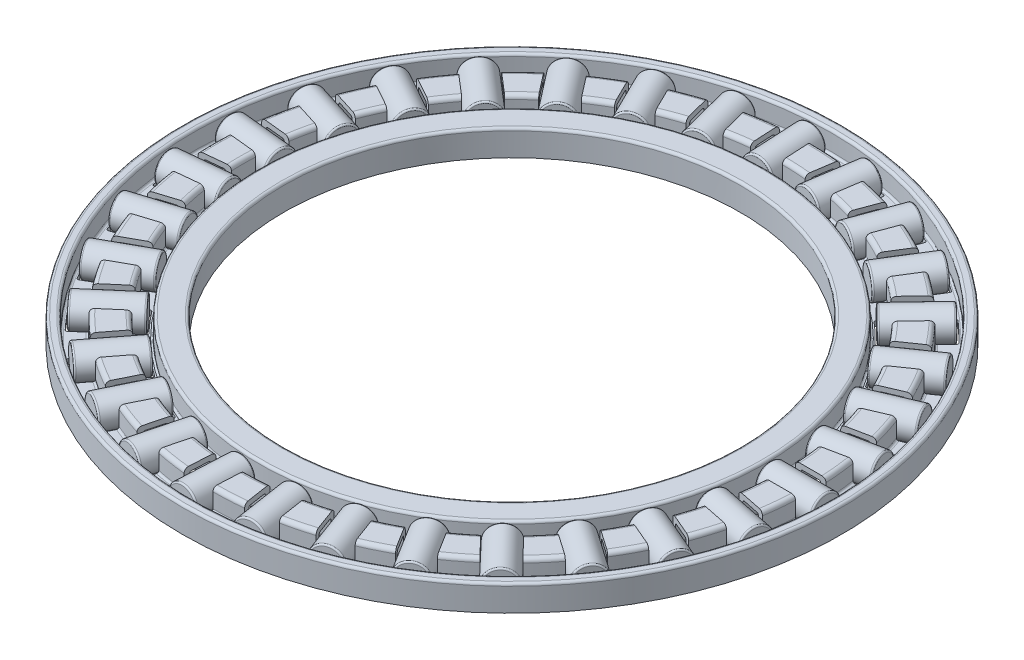
from build123d import *

# Parameters (mm, degrees)
FILLET1_R                = 0.4
FILLET2_R                = 0.4
FILLET3_R                = 0.25
FILLET4_R                = 0.2
CUT_EXTRUDE1_DEPTH       = 46.979621918
FILLET5_R                = 0.150057938
CIRPATTERN1_COUNT        = 31
FILLET5_OF_CIRPATTERN1_R = 0.150057938
SKETCH5_W                = 5.556293558
SKETCH5_H                = 1.5
FILLET6_R                = 0.150057938
CIRPATTERN2_COUNT        = 31


with BuildPart() as part:
    # Sketch3 → Revolve1 (revolve)
    with BuildSketch(Plane(origin=(0, 0, 0), x_dir=(0, 0, -1), z_dir=(1, 0, 0)), mode=Mode.PRIVATE) as revolve1_sk:
        Polygon((23.35, -1.275), (23.35, 0.779166667), (24.175, 0.779166667), (24.175, -1.275), (27.004166667, -1.275), (27.004166667, 0.779166667), (29.004166667, 0.779166667), (29.004166667, -1.275), (31.833333333, -1.275), (31.833333333, 0.779166667), (32.166666667, 0.779166667), (32.166666667, -1.275), (32.5, -1.275), (32.5, 1.275), (31.5, 1.275), (31.5, -0.779166667), (29.5, -0.779166667), (29.5, 1.275), (26.508333333, 1.275), (26.508333333, -0.779166667), (25, -0.779166667), (25, 1.275), (22.525, 1.275), (22.525, -1.275), align=None)
    revolve(revolve1_sk.sketch.rotate(Axis((0, 1.5, 0), (0, -1, 0)), 180), axis=Axis((0, 1.5, 0), (0, -1, 0)))

    # Fillet1
    fillet1_edges = [part.edges().sort_by_distance(p)[0] for p in [
        (0, -1.275, -31.833333333),
        (0, -1.275, -29.004166667),
        (0, -1.275, -27.004166667),
        (0, -1.275, -24.175),
    ]]
    fillet(fillet1_edges, radius=FILLET1_R)

    # Fillet2
    fillet2_edges = [part.edges().sort_by_distance(p)[0] for p in [
        (0, 1.275, -26.508333333),
        (0, 1.275, -29.5),
    ]]
    fillet(fillet2_edges, radius=FILLET2_R)

    # Fillet3
    fillet3_edges = [part.edges().sort_by_distance(p)[0] for p in [
        (0, 1.275, -22.525),
        (0, 1.275, -25),
        (0, 1.275, -31.5),
        (0, 1.275, -32.5),
    ]]
    fillet(fillet3_edges, radius=FILLET3_R)

    # Fillet4
    fillet4_edges = [part.edges().sort_by_distance(p)[0] for p in [
        (0, -0.779166667, -25),
        (0, -0.779166667, -26.508333333),
        (0, -0.779166667, -29.5),
        (0, -0.779166667, -31.5),
        (0, 0.779166667, -29.004166667),
        (0, 0.779166667, -27.004166667),
    ]]
    fillet(fillet4_edges, radius=FILLET4_R)

    # Sketch4 → Cut-Extrude1 (cut, symmetric)
    with BuildSketch(Plane(origin=(0, 0, 0), x_dir=(1, 0, 0), z_dir=(0, 1, 0))):
        with BuildLine():
            Line((25.280538463, 1.5), (31.138892482, 1.5))
            ThreePointArc((31.138892482, 1.5), (31.175, 0), (31.138892482, -1.5))
            Line((31.138892482, -1.5), (25.280538463, -1.5))
            ThreePointArc((25.280538463, -1.5), (25.325, 0), (25.280538463, 1.5))
        make_face()
    cut_extrude1 = extrude(amount=CUT_EXTRUDE1_DEPTH, both=True, mode=Mode.SUBTRACT)

    # Fillet5
    fillet5_edges = [part.edges().sort_by_distance(p)[0] for p in [
        (31.138892482, -1.027083333, -1.5),
        (25.280538463, -1.027083333, 1.5),
        (25.280538463, -1.027083333, -1.5),
        (31.138892482, -1.027083333, 1.5),
    ]]
    fillet(fillet5_edges, radius=FILLET5_R)

    # CirPattern1: Cut-Extrude1 ×31 about axis
    cirpattern1_axis = Axis((0, 0, 0), (0, 1, 0))
    for i in range(1, CIRPATTERN1_COUNT):
        add(cut_extrude1.rotate(cirpattern1_axis, i * 360 / CIRPATTERN1_COUNT), mode=Mode.SUBTRACT)

    # Fillet5 of CirPattern1
    fillet5_of_cirpattern1_edges = [part.edges().sort_by_distance(p)[0] for p in [
        (30.199529743, -1.027083333, -7.737507886),
        (25.064992136, -1.027083333, -3.619640068),
        (24.461096576, -1.027083333, -6.558229892),
        (30.803425304, -1.027083333, -4.798918062),
        (28.023794709, -1.027083333, -13.658241289),
        (23.823282086, -1.027083333, -8.591091646),
        (22.64021452, -1.027083333, -11.347965081),
        (29.206862274, -1.027083333, -10.901367855),
        (24.700762226, -1.027083333, -19.01980469),
        (21.606244067, -1.027083333, -13.210822923),
        (19.892439422, -1.027083333, -15.673113246),
        (26.414566871, -1.027083333, -16.557514366),
        (20.366477636, -1.027083333, -23.602695052),
        (18.504643879, -1.027083333, -17.289701557),
        (16.330265517, -1.027083333, -19.356602314),
        (22.540855998, -1.027083333, -21.535794295),
        (15.198387058, -1.027083333, -27.219288305),
        (14.645461395, -1.027083333, -20.660737778),
        (12.099528623, -1.027083333, -22.247629809),
        (17.744319831, -1.027083333, -25.632396274),
        (9.408072729, -1.027083333, -29.721520697),
        (10.186692001, -1.027083333, -23.185920967),
        (7.373435605, -1.027083333, -24.227836725),
        (12.221329125, -1.027083333, -28.679604938),
        (3.232590796, -1.027083333, -31.006950539),
        (5.31087824, -1.027083333, -24.761869827),
        (2.345473267, -1.027083333, -25.216153159),
        (6.197995769, -1.027083333, -30.552667207),
        (-3.075233784, -1.027083333, -31.022952183),
        (0.2176365, -1.027083333, -25.324064827),
        (-2.778513022, -1.027083333, -25.17211732),
        (-0.079084262, -1.027083333, -31.17489969),
        (-9.257157931, -1.027083333, -29.76887052),
        (-4.884515304, -1.027083333, -24.849489637),
        (-7.788746661, -1.027083333, -24.097532041),
        (-6.352926574, -1.027083333, -30.520828117),
        (-15.060092944, -1.027083333, -27.2960478),
        (-9.786694478, -1.027083333, -23.357573423),
        (-12.480108097, -1.027083333, -22.036390968),
        (-12.366679326, -1.027083333, -28.617230255),
        (-20.246465983, -1.027083333, -23.705721676),
        (-14.28820523, -1.027083333, -20.909395407),
        (-16.660532441, -1.027083333, -19.07307746),
        (-17.874138773, -1.027083333, -25.542039624),
        (-24.603946326, -1.027083333, -19.144880521),
        (-18.204755181, -1.027083333, -17.605184288),
        (-20.158872629, -1.027083333, -15.328909919),
        (-22.649828878, -1.027083333, -21.421154889),
        (-27.954138216, -1.027083333, -13.800245708),
        (-21.376000316, -1.027083333, -13.580214854),
        (-22.831906204, -1.027083333, -10.957175006),
        (-26.498232328, -1.027083333, -16.423285557),
        (-30.159884402, -1.027083333, -7.890627215),
        (-23.672109486, -1.027083333, -8.999269829),
        (-24.570198855, -1.027083333, -6.13685206),
        (-29.261795033, -1.027083333, -10.753044984),
        (-31.130881378, -1.027083333, -1.657965516),
        (-24.999079713, -1.027083333, -4.04989364),
        (-25.302584679, -1.027083333, -1.06528567),
        (-30.827376412, -1.027083333, -4.642573486),
        (-30.827376412, -1.027083333, 4.642573486),
        (-25.302584679, -1.027083333, 1.06528567),
        (-24.999079713, -1.027083333, 4.04989364),
        (-31.130881378, -1.027083333, 1.657965516),
        (-29.261795033, -1.027083333, 10.753044984),
        (-24.570198855, -1.027083333, 6.13685206),
        (-23.672109486, -1.027083333, 8.999269829),
        (-30.159884402, -1.027083333, 7.890627215),
        (-26.498232328, -1.027083333, 16.423285557),
        (-22.831906204, -1.027083333, 10.957175006),
        (-21.376000316, -1.027083333, 13.580214854),
        (-27.954138216, -1.027083333, 13.800245708),
        (-22.649828878, -1.027083333, 21.421154889),
        (-20.158872629, -1.027083333, 15.328909919),
        (-18.204755181, -1.027083333, 17.605184288),
        (-24.603946326, -1.027083333, 19.144880521),
        (-17.874138773, -1.027083333, 25.542039624),
        (-16.660532441, -1.027083333, 19.07307746),
        (-14.28820523, -1.027083333, 20.909395407),
        (-20.246465983, -1.027083333, 23.705721676),
        (-12.366679326, -1.027083333, 28.617230255),
        (-12.480108097, -1.027083333, 22.036390968),
        (-9.786694478, -1.027083333, 23.357573423),
        (-15.060092944, -1.027083333, 27.2960478),
        (-6.352926574, -1.027083333, 30.520828117),
        (-7.788746661, -1.027083333, 24.097532041),
        (-4.884515304, -1.027083333, 24.849489637),
        (-9.257157931, -1.027083333, 29.76887052),
        (-0.079084262, -1.027083333, 31.17489969),
        (-2.778513022, -1.027083333, 25.17211732),
        (0.2176365, -1.027083333, 25.324064827),
        (-3.075233784, -1.027083333, 31.022952183),
        (6.197995769, -1.027083333, 30.552667207),
        (2.345473267, -1.027083333, 25.216153159),
        (5.31087824, -1.027083333, 24.761869827),
        (3.232590796, -1.027083333, 31.006950539),
        (12.221329125, -1.027083333, 28.679604938),
        (7.373435605, -1.027083333, 24.227836725),
        (10.186692001, -1.027083333, 23.185920967),
        (9.408072729, -1.027083333, 29.721520697),
        (17.744319831, -1.027083333, 25.632396274),
        (12.099528623, -1.027083333, 22.247629809),
        (14.645461395, -1.027083333, 20.660737778),
        (15.198387058, -1.027083333, 27.219288305),
        (22.540855998, -1.027083333, 21.535794295),
        (16.330265517, -1.027083333, 19.356602314),
        (18.504643879, -1.027083333, 17.289701557),
        (20.366477636, -1.027083333, 23.602695052),
        (26.414566871, -1.027083333, 16.557514366),
        (19.892439422, -1.027083333, 15.673113246),
        (21.606244067, -1.027083333, 13.210822923),
        (24.700762226, -1.027083333, 19.01980469),
        (29.206862274, -1.027083333, 10.901367855),
        (22.64021452, -1.027083333, 11.347965081),
        (23.823282086, -1.027083333, 8.591091646),
        (28.023794709, -1.027083333, 13.658241289),
        (30.803425304, -1.027083333, 4.798918062),
        (24.461096576, -1.027083333, 6.558229892),
        (25.064992136, -1.027083333, 3.619640068),
        (30.199529743, -1.027083333, 7.737507886),
    ]]
    fillet(fillet5_of_cirpattern1_edges, radius=FILLET5_OF_CIRPATTERN1_R)


with BuildPart() as body_2:
    # Sketch5 → Revolve2 (revolve)
    with BuildSketch(Plane(origin=(0, 0, 0), x_dir=(1, 0, 0), z_dir=(0, 1, 0))):
        with Locations((28.217412361, 0.75)):
            Rectangle(SKETCH5_W, SKETCH5_H)
    revolve(axis=Axis((31.175, 0, 0), (-1, 0, 0)))

    # Fillet6
    fillet6_edges = [body_2.edges().sort_by_distance(p)[0] for p in [
        (30.99555914, 0, 1.5),
        (25.439265582, 0, 1.5),
    ]]
    fillet(fillet6_edges, radius=FILLET6_R)


with BuildPart() as cirpattern2_1:
    # CirPattern2: pattern copy
    add(body_2.part.rotate(Axis((0, 0, 0), (0, 1, 0)), 1 * 360 / CIRPATTERN2_COUNT))


with BuildPart() as cirpattern2_2:
    # CirPattern2: pattern copy
    add(body_2.part.rotate(Axis((0, 0, 0), (0, 1, 0)), 2 * 360 / CIRPATTERN2_COUNT))


with BuildPart() as cirpattern2_3:
    # CirPattern2: pattern copy
    add(body_2.part.rotate(Axis((0, 0, 0), (0, 1, 0)), 3 * 360 / CIRPATTERN2_COUNT))


with BuildPart() as cirpattern2_4:
    # CirPattern2: pattern copy
    add(body_2.part.rotate(Axis((0, 0, 0), (0, 1, 0)), 4 * 360 / CIRPATTERN2_COUNT))


with BuildPart() as cirpattern2_5:
    # CirPattern2: pattern copy
    add(body_2.part.rotate(Axis((0, 0, 0), (0, 1, 0)), 5 * 360 / CIRPATTERN2_COUNT))


with BuildPart() as cirpattern2_6:
    # CirPattern2: pattern copy
    add(body_2.part.rotate(Axis((0, 0, 0), (0, 1, 0)), 6 * 360 / CIRPATTERN2_COUNT))


with BuildPart() as cirpattern2_7:
    # CirPattern2: pattern copy
    add(body_2.part.rotate(Axis((0, 0, 0), (0, 1, 0)), 7 * 360 / CIRPATTERN2_COUNT))


with BuildPart() as cirpattern2_8:
    # CirPattern2: pattern copy
    add(body_2.part.rotate(Axis((0, 0, 0), (0, 1, 0)), 8 * 360 / CIRPATTERN2_COUNT))


with BuildPart() as cirpattern2_9:
    # CirPattern2: pattern copy
    add(body_2.part.rotate(Axis((0, 0, 0), (0, 1, 0)), 9 * 360 / CIRPATTERN2_COUNT))


with BuildPart() as cirpattern2_10:
    # CirPattern2: pattern copy
    add(body_2.part.rotate(Axis((0, 0, 0), (0, 1, 0)), 10 * 360 / CIRPATTERN2_COUNT))


with BuildPart() as cirpattern2_11:
    # CirPattern2: pattern copy
    add(body_2.part.rotate(Axis((0, 0, 0), (0, 1, 0)), 11 * 360 / CIRPATTERN2_COUNT))


with BuildPart() as cirpattern2_12:
    # CirPattern2: pattern copy
    add(body_2.part.rotate(Axis((0, 0, 0), (0, 1, 0)), 12 * 360 / CIRPATTERN2_COUNT))


with BuildPart() as cirpattern2_13:
    # CirPattern2: pattern copy
    add(body_2.part.rotate(Axis((0, 0, 0), (0, 1, 0)), 13 * 360 / CIRPATTERN2_COUNT))


with BuildPart() as cirpattern2_14:
    # CirPattern2: pattern copy
    add(body_2.part.rotate(Axis((0, 0, 0), (0, 1, 0)), 14 * 360 / CIRPATTERN2_COUNT))


with BuildPart() as cirpattern2_15:
    # CirPattern2: pattern copy
    add(body_2.part.rotate(Axis((0, 0, 0), (0, 1, 0)), 15 * 360 / CIRPATTERN2_COUNT))


with BuildPart() as cirpattern2_16:
    # CirPattern2: pattern copy
    add(body_2.part.rotate(Axis((0, 0, 0), (0, 1, 0)), 16 * 360 / CIRPATTERN2_COUNT))


with BuildPart() as cirpattern2_17:
    # CirPattern2: pattern copy
    add(body_2.part.rotate(Axis((0, 0, 0), (0, 1, 0)), 17 * 360 / CIRPATTERN2_COUNT))


with BuildPart() as cirpattern2_18:
    # CirPattern2: pattern copy
    add(body_2.part.rotate(Axis((0, 0, 0), (0, 1, 0)), 18 * 360 / CIRPATTERN2_COUNT))


with BuildPart() as cirpattern2_19:
    # CirPattern2: pattern copy
    add(body_2.part.rotate(Axis((0, 0, 0), (0, 1, 0)), 19 * 360 / CIRPATTERN2_COUNT))


with BuildPart() as cirpattern2_20:
    # CirPattern2: pattern copy
    add(body_2.part.rotate(Axis((0, 0, 0), (0, 1, 0)), 20 * 360 / CIRPATTERN2_COUNT))


with BuildPart() as cirpattern2_21:
    # CirPattern2: pattern copy
    add(body_2.part.rotate(Axis((0, 0, 0), (0, 1, 0)), 21 * 360 / CIRPATTERN2_COUNT))


with BuildPart() as cirpattern2_22:
    # CirPattern2: pattern copy
    add(body_2.part.rotate(Axis((0, 0, 0), (0, 1, 0)), 22 * 360 / CIRPATTERN2_COUNT))


with BuildPart() as cirpattern2_23:
    # CirPattern2: pattern copy
    add(body_2.part.rotate(Axis((0, 0, 0), (0, 1, 0)), 23 * 360 / CIRPATTERN2_COUNT))


with BuildPart() as cirpattern2_24:
    # CirPattern2: pattern copy
    add(body_2.part.rotate(Axis((0, 0, 0), (0, 1, 0)), 24 * 360 / CIRPATTERN2_COUNT))


with BuildPart() as cirpattern2_25:
    # CirPattern2: pattern copy
    add(body_2.part.rotate(Axis((0, 0, 0), (0, 1, 0)), 25 * 360 / CIRPATTERN2_COUNT))


with BuildPart() as cirpattern2_26:
    # CirPattern2: pattern copy
    add(body_2.part.rotate(Axis((0, 0, 0), (0, 1, 0)), 26 * 360 / CIRPATTERN2_COUNT))


with BuildPart() as cirpattern2_27:
    # CirPattern2: pattern copy
    add(body_2.part.rotate(Axis((0, 0, 0), (0, 1, 0)), 27 * 360 / CIRPATTERN2_COUNT))


with BuildPart() as cirpattern2_28:
    # CirPattern2: pattern copy
    add(body_2.part.rotate(Axis((0, 0, 0), (0, 1, 0)), 28 * 360 / CIRPATTERN2_COUNT))


with BuildPart() as cirpattern2_29:
    # CirPattern2: pattern copy
    add(body_2.part.rotate(Axis((0, 0, 0), (0, 1, 0)), 29 * 360 / CIRPATTERN2_COUNT))


with BuildPart() as cirpattern2_30:
    # CirPattern2: pattern copy
    add(body_2.part.rotate(Axis((0, 0, 0), (0, 1, 0)), 30 * 360 / CIRPATTERN2_COUNT))


solid = Compound([part.part, body_2.part, cirpattern2_1.part, cirpattern2_2.part, cirpattern2_3.part, cirpattern2_4.part, cirpattern2_5.part, cirpattern2_6.part, cirpattern2_7.part, cirpattern2_8.part, cirpattern2_9.part, cirpattern2_10.part, cirpattern2_11.part, cirpattern2_12.part, cirpattern2_13.part, cirpattern2_14.part, cirpattern2_15.part, cirpattern2_16.part, cirpattern2_17.part, cirpattern2_18.part, cirpattern2_19.part, cirpattern2_20.part, cirpattern2_21.part, cirpattern2_22.part, cirpattern2_23.part, cirpattern2_24.part, cirpattern2_25.part, cirpattern2_26.part, cirpattern2_27.part, cirpattern2_28.part, cirpattern2_29.part, cirpattern2_30.part])
